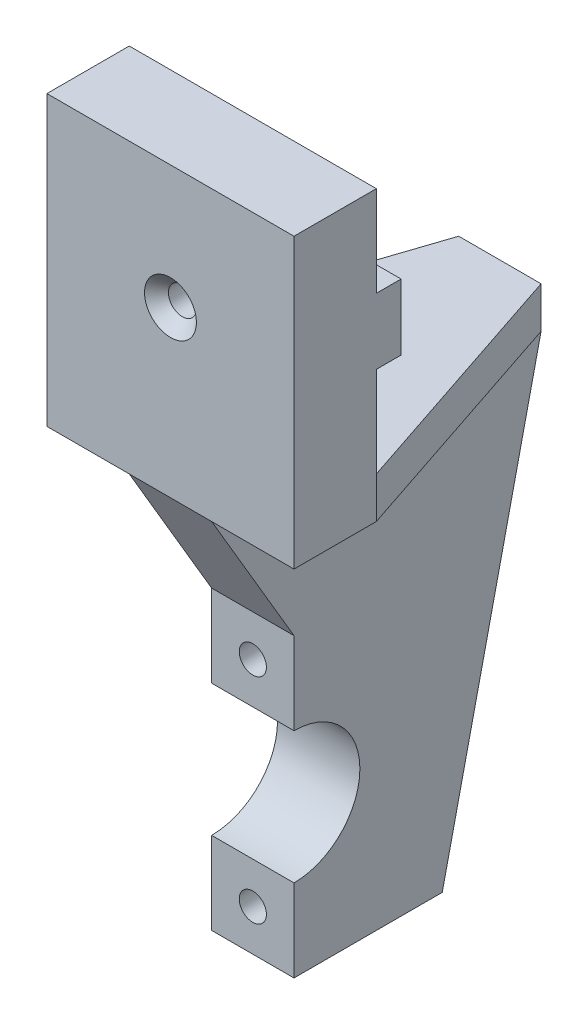
from build123d import *

# Parameters (mm, degrees)
SKETCH_1_W      = 30
SKETCH_1_H      = 30
EXTRUDE_1_DEPTH = 10
EXTRUDE_2_DEPTH = 5
EXTRUDE_3_DEPTH = 5
SKETCH_6_W      = 5
SKETCH_6_H      = 8
EXTRUDE_4_DEPTH = 3


# Read off the part's stored shape, not the designer's step: 高级异型孔1, 高级异型孔2
with BuildPart() as part:
    # 草图1 → 凸台-拉伸1 (new body)
    with BuildSketch(Plane.XY):
        with Locations((15, 15)):
            Rectangle(SKETCH_1_W, SKETCH_1_H)
    extrude(amount=EXTRUDE_1_DEPTH)

    # 草图2 → 凸台-拉伸2 (add)
    with BuildSketch(Plane.XZ):
        Polygon((0, 10), (30, 10), (30, 0), (20, -30), (10, -30), (0, 0), align=None)
    extrude(amount=EXTRUDE_2_DEPTH)

    # 草图3 → 凸台-拉伸3 (add, symmetric)
    with BuildSketch(Plane(origin=(15, 0, 0), x_dir=(0, 0, -1), z_dir=(1, 0, 0))):
        with BuildLine():
            Line((0, -48), (0, -58))
            Line((0, -58), (18, -58))
            Line((18, -58), (30, -5))
            Line((30, -5), (-10, -5))
            Line((-10, -5), (0, -22))
            Line((0, -22), (0, -32))
            ThreePointArc((0, -32), (8, -40), (0, -48))
        make_face()
    extrude(amount=EXTRUDE_3_DEPTH, both=True)

    # 草图6 → 凸台-拉伸4 (add)
    with BuildSketch(Plane(origin=(0, 0, 0), x_dir=(-1, 0, 0), z_dir=(0, 0, -1))):
        with Locations((-27.5, 15)):
            Rectangle(SKETCH_6_W, SKETCH_6_H)
        with Locations((-2.5, 15)):
            Rectangle(SKETCH_6_W, SKETCH_6_H)
    extrude(amount=EXTRUDE_4_DEPTH)

    # 高级异型孔1 outline → 高级异型孔1 (revolve, cut)
    with BuildSketch(Plane(origin=(15, 15, 0), x_dir=(1, 0, 0), z_dir=(0, -1, 0))):
        Polygon((3.15, 10), (0, 10), (0, 0), (1.7, 0), (1.7, 8.55), align=None)
    revolve(axis=Axis((15, 15, 0), (0, 0, 1)), mode=Mode.SUBTRACT)

    # 高级异型孔2 outline → 高级异型孔2 (revolve, cut)
    with BuildSketch(Plane(origin=(15, -53, 0), x_dir=(1, 0, 0), z_dir=(0, -1, 0))):
        Polygon((0, -10.991420021), (1.65, -10), (1.65, 0), (0, 0), align=None)
    revolve(axis=Axis((15, -53, 0), (0, 0, 1)), mode=Mode.SUBTRACT)

    # Other 2 2 outline → Other 2 2 (revolve, cut)
    with BuildSketch(Plane(origin=(15, -27, 0), x_dir=(1, 0, 0), z_dir=(0, -1, 0))):
        Polygon((0, -10.991420021), (1.65, -10), (1.65, 0), (0, 0), align=None)
    revolve(axis=Axis((15, -27, 0), (0, 0, 1)), mode=Mode.SUBTRACT)


solid = part.part
